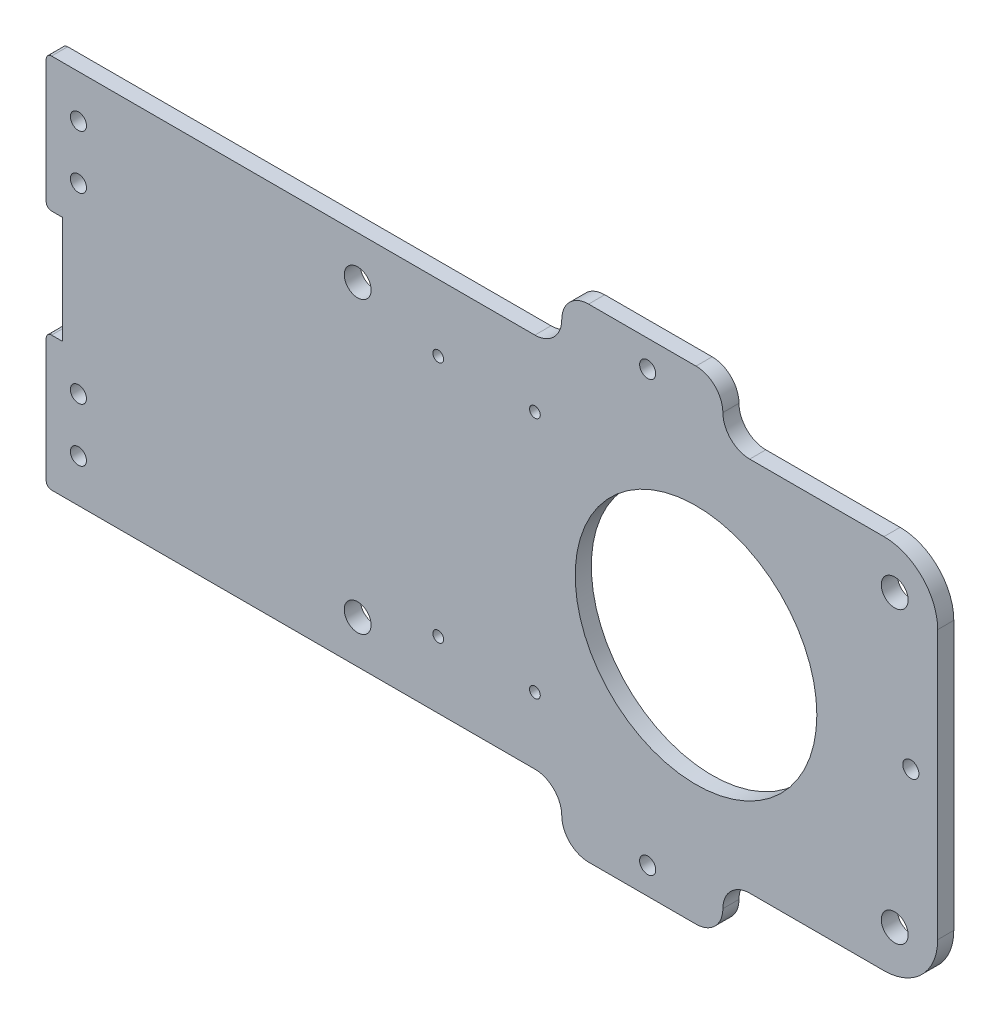
from build123d import *

# Parameters (mm, degrees)
SKETCH_1_W          = 166
SKETCH_1_H          = 70
EXTRUDE_1_DEPTH     = 3
SKETCH_2_W          = 3
SKETCH_2_H          = 20
CUT_EXTRUDE_1_DEPTH = 91.1276872
SKETCH_3_R          = 1.5
CUT_EXTRUDE_2_DEPTH = 91.1276872
SKETCH_4_R          = 1
CUT_EXTRUDE_3_DEPTH = 91.1276872
FILLET_1_R          = 1
SKETCH_5_R          = 22.5
CUT_EXTRUDE_4_DEPTH = 91.1276872
SKETCH_6_R          = 2.5
CUT_EXTRUDE_5_DEPTH = 91.1276872
FILLET_2_R          = 10
SKETCH_7_W          = 30
SKETCH_7_H          = 10
EXTRUDE_2_DEPTH     = 3
FILLET_START        = -1
FILLET_3_DEPTH      = 5
FILLET_3_2_DEPTH    = 3
SKETCH_8_R          = 1.5
CUT_EXTRUDE_6_DEPTH = 95.461632423
SKETCH_9_R          = 1.5
CUT_EXTRUDE_7_DEPTH = 95.461632423


with BuildPart() as part:
    # 草图1 → 凸台-拉伸1 (new body)
    with BuildSketch(Plane.XY):
        Rectangle(SKETCH_1_W, SKETCH_1_H)
    extrude(amount=EXTRUDE_1_DEPTH)

    # 草图2 → 切除-拉伸1 (cut, through all)
    with BuildSketch(Plane.XY.offset(3)):
        with Locations((-81.5, 0)):
            Rectangle(SKETCH_2_W, SKETCH_2_H)
    extrude(amount=-CUT_EXTRUDE_1_DEPTH, mode=Mode.SUBTRACT)

    # 草图3 → 切除-拉伸2 (cut, through all)
    with BuildSketch(Plane.XY.offset(3)):
        with Locations((-77, 27)):
            Circle(SKETCH_3_R)
        with Locations((-77, 17)):
            Circle(SKETCH_3_R)
        with Locations(Location((-77, -17, 0), (0, 0, 180))):
            Circle(SKETCH_3_R)
        with Locations(Location((-77, -27, 0), (0, 0, 180))):
            Circle(SKETCH_3_R)
    extrude(amount=-CUT_EXTRUDE_2_DEPTH, mode=Mode.SUBTRACT)

    # 草图4 → 切除-拉伸3 (cut, through all)
    with BuildSketch(Plane.XY.offset(3)):
        with Locations((-10, 22.6)):
            Circle(SKETCH_4_R)
        with Locations((8, 22.6)):
            Circle(SKETCH_4_R)
        with Locations(Location((8, -22.6, 0), (0, 0, 180))):
            Circle(SKETCH_4_R)
        with Locations(Location((-10, -22.6, 0), (0, 0, 180))):
            Circle(SKETCH_4_R)
    extrude(amount=-CUT_EXTRUDE_3_DEPTH, mode=Mode.SUBTRACT)

    # 圆角1
    fillet_1_edges = [part.edges().sort_by_distance(p)[0] for p in [
        (-83, -10, 1.5),
        (-83, 10, 1.5),
        (-83, -35, 1.5),
        (-83, 35, 1.5),
    ]]
    fillet(fillet_1_edges, radius=FILLET_1_R)

    # 草图5 → 切除-拉伸4 (cut, through all)
    with BuildSketch(Plane.XY.offset(3)):
        with Locations((38, 0)):
            Circle(SKETCH_5_R)
    extrude(amount=-CUT_EXTRUDE_4_DEPTH, mode=Mode.SUBTRACT)

    # 草图6 → 切除-拉伸5 (cut, through all)
    with BuildSketch(Plane.XY.offset(3)):
        with Locations((75, 27)):
            Circle(SKETCH_6_R)
        with Locations((-25, 27)):
            Circle(SKETCH_6_R)
        with Locations(Location((75, -27, 0), (0, 0, 180))):
            Circle(SKETCH_6_R)
        with Locations(Location((-25, -27, 0), (0, 0, 180))):
            Circle(SKETCH_6_R)
    extrude(amount=-CUT_EXTRUDE_5_DEPTH, mode=Mode.SUBTRACT)

    # 圆角2
    fillet_2_edges = [part.edges().sort_by_distance(p)[0] for p in [
        (83, -35, 1.5),
        (83, 35, 1.5),
    ]]
    fillet(fillet_2_edges, radius=FILLET_2_R)

    # 草图7 → 凸台-拉伸2 (add)
    with BuildSketch(Plane.XY.offset(3)):
        with Locations((28, 40)):
            Rectangle(SKETCH_7_W, SKETCH_7_H)
        with Locations((28, -40)):
            Rectangle(SKETCH_7_W, SKETCH_7_H)
    extrude(amount=-EXTRUDE_2_DEPTH)

    # 圆角3: read off the stored shape, not the designer's step
    # 圆角3 outline → 圆角3 (cut)
    with BuildSketch(Plane.XY.offset(FILLET_START)):
        with BuildLine():
            Line((13, -45), (18, -45))
            ThreePointArc((18, -45), (14.464466094, -43.535533906), (13, -40))
            Line((13, -40), (13, -45))
        make_face()
        with BuildLine():
            ThreePointArc((43, -40), (41.535533906, -43.535533906), (38, -45))
            Line((38, -45), (43, -45))
            Line((43, -45), (43, -40))
        make_face()
        with BuildLine():
            Line((43, 45), (38, 45))
            ThreePointArc((38, 45), (41.535533906, 43.535533906), (43, 40))
            Line((43, 40), (43, 45))
        make_face()
        with BuildLine():
            ThreePointArc((13, 40), (14.464466094, 43.535533906), (18, 45))
            Line((18, 45), (13, 45))
            Line((13, 45), (13, 40))
        make_face()
    extrude(amount=FILLET_3_DEPTH, mode=Mode.SUBTRACT)

    # Fillet 3 2 outline → Fillet 3 2 (add)
    with BuildSketch(Plane.XY):
        with BuildLine():
            Line((43, -35), (43, -40))
            ThreePointArc((43, -40), (44.464466094, -36.464466094), (48, -35))
            Line((48, -35), (43, -35))
        make_face()
        with BuildLine():
            ThreePointArc((8, -35), (11.535533906, -36.464466094), (13, -40))
            Line((13, -40), (13, -35))
            Line((13, -35), (8, -35))
        make_face()
        with BuildLine():
            Line((13, 35), (13, 40))
            ThreePointArc((13, 40), (11.535533906, 36.464466094), (8, 35))
            Line((8, 35), (13, 35))
        make_face()
        with BuildLine():
            ThreePointArc((48, 35), (44.464466094, 36.464466094), (43, 40))
            Line((43, 40), (43, 35))
            Line((43, 35), (48, 35))
        make_face()
    extrude(amount=FILLET_3_2_DEPTH)

    # 草图8 → 切除-拉伸6 (cut, through all)
    with BuildSketch(Plane(origin=(0, 0, 0), x_dir=(-1, 0, 0), z_dir=(0, 0, -1))):
        with Locations((-78, 0)):
            Circle(SKETCH_8_R)
    extrude(amount=-CUT_EXTRUDE_6_DEPTH, mode=Mode.SUBTRACT)

    # 草图9 → 切除-拉伸7 (cut, through all)
    with BuildSketch(Plane(origin=(0, 0, 0), x_dir=(-1, 0, 0), z_dir=(0, 0, -1))):
        with Locations((-29, 40)):
            Circle(SKETCH_9_R)
        with Locations(Location((-29, -40, 0), (0, 0, 180))):
            Circle(SKETCH_9_R)
    extrude(amount=-CUT_EXTRUDE_7_DEPTH, mode=Mode.SUBTRACT)


solid = part.part
